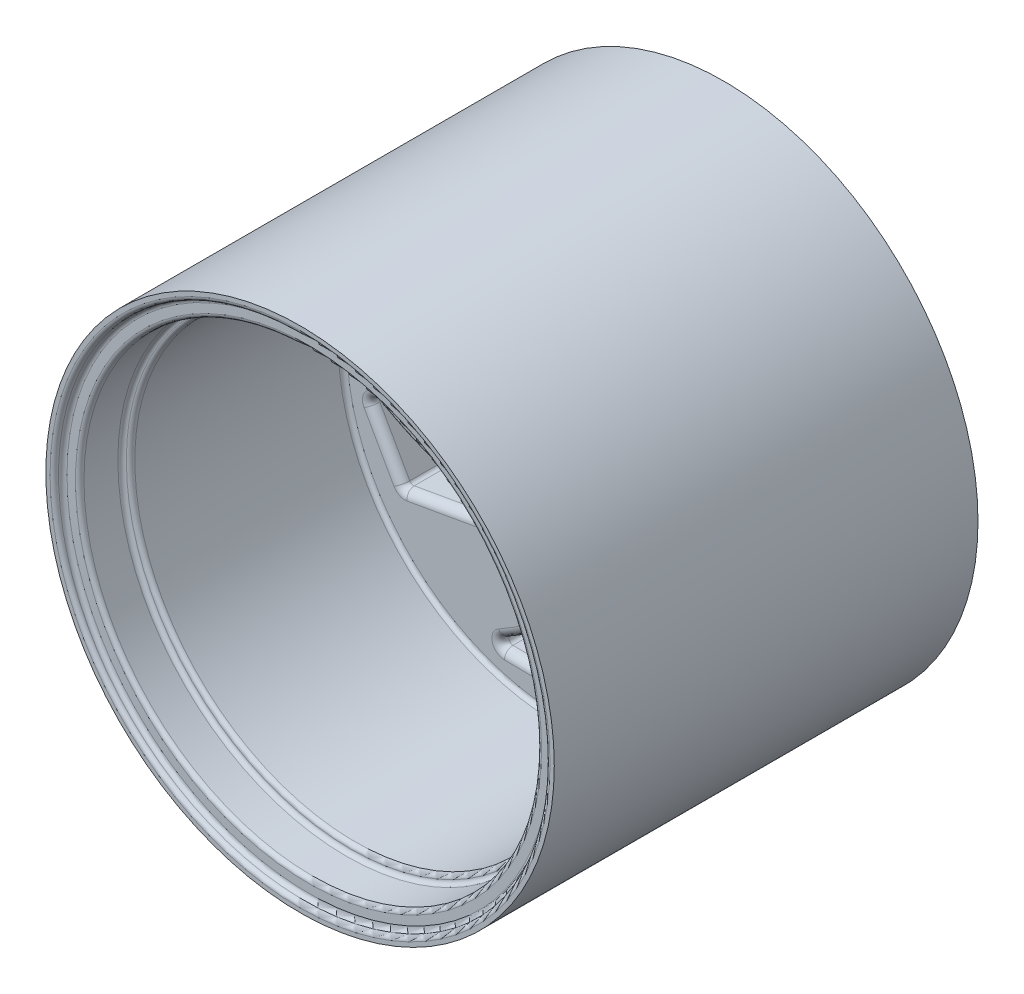
from build123d import *

# Parameters (mm, degrees)
IZIM1_R                     = 30
Y_KSEKLIK_EKSTR_ZYON1_DEPTH = 50
IZIM2_R                     = 29
KES_EKSTR_ZYON1_DEPTH       = 1
KES_EKSTR_ZYON2_START       = -1
IZIM3_R                     = 29
KES_EKSTR_ZYON2_DEPTH       = 1
IZIM4_R                     = 27
KES_EKSTR_ZYON3_DEPTH       = 5
IZIM5_R                     = 26
KES_EKSTR_ZYON4_DEPTH       = 25
IZIM6_R                     = 10
IZIM6_R_2                   = 8
IZIM6_R_3                   = 1
Y_KSEKLIK_EKSTR_ZYON2_DEPTH = 2
IZIM8_R                     = 2
KES_EKSTR_ZYON5_DEPTH       = 59.412250759
KES_EKSTR_ZYON6_DEPTH       = 59.412250759
IZIM12_R                    = 29
KES_EKSTR_ZYON7_DEPTH       = 10
Y_KSEKLIK_EKSTR_ZYON4_START = 10
Y_KSEKLIK_EKSTR_ZYON4_DEPTH = 10
RADYUS1_R                   = 0.5
RADYUS5_R                   = 0.5
RADYUS6_R                   = 1
RADYUS7_R                   = 0.5


# Some blends are built 0.0001 mm under size
with BuildPart() as part:
    # Çizim1 → Yükseklik-Ekstrüzyon1 (new body)
    with BuildSketch(Plane.XY):
        with Locations((-8.148787303, -1.554097453)):
            Circle(IZIM1_R)
    extrude(amount=Y_KSEKLIK_EKSTR_ZYON1_DEPTH)

    # Çizim2 → Kes-Ekstrüzyon1 (cut)
    with BuildSketch(Plane(origin=(0, 0, 0), x_dir=(-1, 0, 0), z_dir=(0, 0, -1))):
        with Locations((8.148787303, -1.554097453)):
            Circle(IZIM2_R)
    extrude(amount=-KES_EKSTR_ZYON1_DEPTH, mode=Mode.SUBTRACT)

    # Çizim3 → Kes-Ekstrüzyon2 (cut)
    with BuildSketch(Plane.XY.offset(50).offset(KES_EKSTR_ZYON2_START)):
        with Locations(Location((-8.148787303, -1.554097453, 0), (0, 0, 180))):
            Circle(IZIM3_R)
    extrude(amount=KES_EKSTR_ZYON2_DEPTH, mode=Mode.SUBTRACT)

    # Çizim4 → Kes-Ekstrüzyon3 (cut)
    with BuildSketch(Plane.XY.offset(49)):
        with Locations((-8.148787303, -1.554097453)):
            Circle(IZIM4_R)
    extrude(amount=-KES_EKSTR_ZYON3_DEPTH, mode=Mode.SUBTRACT)

    # Çizim5 → Kes-Ekstrüzyon4 (cut)
    with BuildSketch(Plane.XY.offset(44)):
        with Locations((-8.148787303, -1.554097453)):
            Circle(IZIM5_R)
    extrude(amount=-KES_EKSTR_ZYON4_DEPTH, mode=Mode.SUBTRACT)

    # Çizim6 → Yükseklik-Ekstrüzyon2 (add)
    # profile 1 of 9: a face of its own
    with BuildSketch(Plane.XY.offset(19)):
        with Locations((-8.148787303, -1.554097453)):
            Circle(IZIM6_R)
        with Locations((-8.148787303, -1.554097453)):
            Circle(IZIM6_R_2, mode=Mode.SUBTRACT)
    # profile 2 of 9: a face of its own
    with BuildSketch(Plane.XY.offset(19)):
        with Locations((-8.148787303, 4.445902547)):
            Circle(IZIM6_R_3)
    # profile 3 of 9: a face of its own
    with BuildSketch(Plane.XY.offset(19)):
        with Locations((-14.148787303, -1.554097453)):
            Circle(IZIM6_R_3)
    # profile 4 of 9: a face of its own
    with BuildSketch(Plane.XY.offset(19)):
        with Locations((-12.39142799, -5.79673814)):
            Circle(IZIM6_R_3)
    # profile 5 of 9: a face of its own
    with BuildSketch(Plane.XY.offset(19)):
        with Locations((-8.148787303, -7.554097453)):
            Circle(IZIM6_R_3)
    # profile 6 of 9: a face of its own
    with BuildSketch(Plane.XY.offset(19)):
        with Locations((-3.906146615, -5.79673814)):
            Circle(IZIM6_R_3)
    # profile 7 of 9: a face of its own
    with BuildSketch(Plane.XY.offset(19)):
        with Locations((-3.906146615, 2.688543234)):
            Circle(IZIM6_R_3)
    # profile 8 of 9: a face of its own
    with BuildSketch(Plane.XY.offset(19)):
        with Locations((-12.39142799, 2.688543234)):
            Circle(IZIM6_R_3)
    # profile 9 of 9: a face of its own
    with BuildSketch(Plane.XY.offset(19)):
        with Locations((-2.148787303, -1.554097453)):
            Circle(IZIM6_R_3)
    extrude(amount=Y_KSEKLIK_EKSTR_ZYON2_DEPTH)

    # Çizim8 → Kes-Ekstrüzyon5 (cut, through all)
    with BuildSketch(Plane.XY.offset(19)):
        with Locations((-8.148787303, -1.554097453)):
            Circle(IZIM8_R)
    extrude(amount=-KES_EKSTR_ZYON5_DEPTH, mode=Mode.SUBTRACT)

    # Çizim9 → Kes-Ekstrüzyon6 (cut, through all)
    with BuildSketch(Plane.XY.offset(19)):
        with BuildLine():
            Line((-13.925732405, 6.608433116), (-8.833557811, 20.638443128))
            Line((-8.833557811, 20.638443128), (0.723069615, 20.525490043))
            add(Edge.make_bspline(
                [(0.723069615, 20.525490043), (-8.727629056, 15.967451289), (-13.925732405, 6.608433116)],
                knots=[0, 0, 0, 1, 1, 1], degree=2))
        make_face()
        with BuildLine():
            Line((-3.968301022, 7.530149046), (10.72813136, 10.135201494))
            Line((10.72813136, 10.135201494), (15.408624833, 1.802442826))
            add(Edge.make_bspline(
                [(15.408624833, 1.802442826), (6.735898145, 7.707968582), (-3.968301022, 7.530149046)],
                knots=[0, 0, 0, 1, 1, 1], degree=2))
        make_face()
        with BuildLine():
            Line((1.80864408, -0.632381522), (11.412901869, -12.057339087))
            Line((11.412901869, -12.057339087), (6.536767916, -20.277144671))
            add(Edge.make_bspline(
                [(6.536767916, -20.277144671), (7.314739899, -9.813580161), (1.80864408, -0.632381522)],
                knots=[0, 0, 0, 1, 1, 1], degree=2))
        make_face()
        with BuildLine():
            Line((-2.3718422, -9.716628021), (-7.464016794, -23.746638033))
            Line((-7.464016794, -23.746638033), (-17.02064422, -23.633684949))
            add(Edge.make_bspline(
                [(-17.02064422, -23.633684949), (-7.569945549, -19.075646195), (-2.3718422, -9.716628021)],
                knots=[0, 0, 0, 1, 1, 1], degree=2))
        make_face()
        with BuildLine():
            Line((-12.329273583, -10.638343952), (-27.025705965, -13.243396399))
            Line((-27.025705965, -13.243396399), (-31.706199438, -4.910637732))
            add(Edge.make_bspline(
                [(-31.706199438, -4.910637732), (-23.03347275, -10.816163487), (-12.329273583, -10.638343952)],
                knots=[0, 0, 0, 1, 1, 1], degree=2))
        make_face()
        with BuildLine():
            Line((-18.106218685, -2.475813384), (-27.710476474, 8.949144181))
            Line((-27.710476474, 8.949144181), (-22.834342521, 17.168949765))
            add(Edge.make_bspline(
                [(-22.834342521, 17.168949765), (-23.612314504, 6.705385255), (-18.106218685, -2.475813384)],
                knots=[0, 0, 0, 1, 1, 1], degree=2))
        make_face()
    extrude(amount=-KES_EKSTR_ZYON6_DEPTH, mode=Mode.SUBTRACT)

    # Çizim12 → Kes-Ekstrüzyon7 (cut)
    with BuildSketch(Plane(origin=(0, 0, 1), x_dir=(-1, 0, 0), z_dir=(0, 0, -1))):
        with Locations((8.148787303, -1.554097453)):
            Circle(IZIM12_R)
    extrude(amount=-KES_EKSTR_ZYON7_DEPTH, mode=Mode.SUBTRACT)

    # Çizim13 → Yükseklik-Ekstrüzyon4 (add)
    with BuildSketch(Plane(origin=(0, 0, 11), x_dir=(-1, 0, 0), z_dir=(0, 0, -1)).offset(Y_KSEKLIK_EKSTR_ZYON4_START)):
        with BuildLine():
            Line((25.695028079, 21.53686796), (26.090507249, 21.230932957))
            Line((26.090507249, 21.230932957), (13.239027353, 4.617568143))
            ThreePointArc((13.239027353, 4.617568143), (15.55174657, 1.478425274), (16.105928887, -2.381078591))
            Line((16.105928887, -2.381078591), (36.919270337, -5.204105))
            Line((36.919270337, -5.204105), (36.852062437, -5.699567509))
            Line((36.852062437, -5.699567509), (16.038726518, -2.87654185))
            ThreePointArc((16.038726518, -2.87654185), (14.476508655, -6.448986878), (11.411171421, -8.858674776))
            Line((11.411171421, -8.858674776), (19.37302956, -28.295070413))
            Line((19.37302956, -28.295070413), (18.91034249, -28.484597919))
            Line((18.91034249, -28.484597919), (10.948486467, -9.048207446))
            ThreePointArc((10.948486467, -9.048207446), (7.073549388, -9.481509605), (3.454029836, -8.031693638))
            Line((3.454029836, -8.031693638), (-9.397453474, -24.645062866))
            Line((-9.397453474, -24.645062866), (-9.792932644, -24.339127863))
            Line((-9.792932644, -24.339127863), (3.058547252, -7.725763049))
            ThreePointArc((3.058547252, -7.725763049), (0.745828035, -4.58662018), (0.191645718, -0.727116315))
            Line((0.191645718, -0.727116315), (-20.621695731, 2.095910094))
            Line((-20.621695731, 2.095910094), (-20.554487832, 2.591372603))
            Line((-20.554487832, 2.591372603), (0.258848088, -0.231653055))
            ThreePointArc((0.258848088, -0.231653055), (1.82106595, 3.340791972), (4.886403184, 5.75047987))
            Line((4.886403184, 5.75047987), (-3.075454955, 25.186875507))
            Line((-3.075454955, 25.186875507), (-2.612767885, 25.376403013))
            Line((-2.612767885, 25.376403013), (5.349088138, 5.94001254))
            ThreePointArc((5.349088138, 5.94001254), (9.224025217, 6.373314699), (12.843544769, 4.923498732))
            Line((12.843544769, 4.923498732), (25.695028079, 21.53686796))
        make_face()
        Polygon((13.35894405, -5.185570983), (13.898814007, 1.142293883), (8.688657259, 4.773767413), (2.938630555, 2.077376077), (2.398760599, -4.250488789), (7.608917346, -7.881962319), align=None, mode=Mode.SUBTRACT)
    extrude(amount=-Y_KSEKLIK_EKSTR_ZYON4_DEPTH)

    # Radyus1
    radyus1_edges = [part.edges().sort_by_distance(p)[0] for p in [
        (20.851212697, -1.554097453, 49),
        (20.851212697, -1.554097453, 50),
        (-35.148787303, -1.554097453, 44),
        (-35.148787303, -1.554097453, 49),
        (-34.148787303, -1.554097453, 19),
        (-34.148787303, -1.554097453, 44),
    ]]
    fillet(radyus1_edges, radius=RADYUS1_R - 0.0001)  # a hair under: the kernel refuses the full size

    # Radyus5
    # the kernel refuses this fillet: 0.5 mm, written as the material it adds along each edge
    with BuildSketch(Plane(origin=(-22.834342521, 17.168949765, 19), x_dir=(-0.045917830144074794, -0.9989452201571715, 0), z_dir=(0, 0, -1)), Plane(origin=(-31.706199438, -4.910637732, 19), x_dir=(0.8421530225731109, -0.5392386174700152, 0), z_dir=(0, 0, -1)), Plane(origin=(-17.02064422, -23.633684949, 19), x_dir=(0.888070852717188, 0.459706602687156, 0), z_dir=(0, 0, -1)), Plane(origin=(6.536767916, -20.277144671, 19), x_dir=(0.045917830144079165, 0.9989452201571712, 0), z_dir=(0, 0, -1)), Plane(origin=(15.408624833, 1.802442826, 19), x_dir=(-0.8421530225731088, 0.5392386174700184, 0), z_dir=(0, 0, -1)), Plane(origin=(0.723069615, 20.525490043, 19), x_dir=(-0.8880708527171902, -0.45970660268715174, 0), z_dir=(0, 0, -1))) as radyus5_piece_1:
        with BuildLine():
            CenterArc((2.001629054, 0.499794242), RADYUS5_R, 118.04534383, 150.310869402)
            Line((1.766543964, 0.941082131), (1.761842262, 0.949907889))
            Line((1.761842262, 0.949907889), (-0.004701702, 0.008825758))
            Line((-0.004701702, 0.008825758), (0.000282763, -0.009996001))
            ThreePointArc((0.000282763, -0.009996001), (0.993642712, 0.00415476), (1.98699942, -0.009995885))
            Line((1.98699942, -0.009995885), (1.987286276, 0))
        make_face()
    extrude(amount=8)
    with BuildSketch(Plane(origin=(-18.106218685, -2.475813384, 19), x_dir=(-0.4605887665447725, 0.8876136480095184, 0), z_dir=(0, 0, -1)), Plane(origin=(-12.329273583, -10.638343952, 19), x_dir=(-0.998990351194408, 0.04492525147924159, 0), z_dir=(0, 0, -1)), Plane(origin=(-2.3718422, -9.716628021, 19), x_dir=(-0.5384015846496285, -0.8426883965302768, 0), z_dir=(0, 0, -1)), Plane(origin=(1.80864408, -0.632381522, 19), x_dir=(0.46058876654478326, -0.8876136480095126, 0), z_dir=(0, 0, -1)), Plane(origin=(-3.968301022, 7.530149046, 19), x_dir=(0.9989903511944087, -0.044925251479229544, 0), z_dir=(0, 0, -1)), Plane(origin=(-13.925732405, 6.608433116, 19), x_dir=(0.5384015846496182, 0.8426883965302833, 0), z_dir=(0, 0, -1))) as radyus5_piece_2:
        with BuildLine():
            CenterArc((4.514789372, -0.498983263), RADYUS5_R, 93.654521519, 163.718887163)
            Line((4.405491299, -0.986890971), (4.403305337, -0.996649125))
            Line((4.403305337, -0.996649125), (-0.002185961, -0.009758154))
            Line((-0.002185961, -0.009758154), (0.000615121, 0.009981063))
            ThreePointArc((0.000615121, 0.009981063), (2.241425805, -0.060297124), (4.482281874, 0.009979665))
            Line((4.482281874, 0.009979665), (4.482919275, 0))
        make_face()
    extrude(amount=8)
    with BuildSketch(Plane(origin=(-27.710476474, 8.949144181, 19), x_dir=(0.6434785417464973, -0.7654641508991792, 0), z_dir=(0, 0, -1)), Plane(origin=(-27.025705965, -13.243396399, 19), x_dir=(0.984650671238221, 0.17453668849305284, 0), z_dir=(0, 0, -1)), Plane(origin=(-7.464016794, -23.746638033, 19), x_dir=(0.34117212949171294, 0.9400008393922262, 0), z_dir=(0, 0, -1)), Plane(origin=(11.412901869, -12.057339087, 19), x_dir=(-0.6434785417465096, 0.7654641508991689, 0), z_dir=(0, 0, -1)), Plane(origin=(10.72813136, 10.135201494, 19), x_dir=(-0.9846506712382194, -0.17453668849306167, 0), z_dir=(0, 0, -1)), Plane(origin=(-8.833557811, 20.638443128, 19), x_dir=(-0.3411721294917053, -0.9400008393922289, 0), z_dir=(0, 0, -1))) as radyus5_piece_3:
        with BuildLine():
            CenterArc((RADYUS5_R * 0.70972912952, -RADYUS5_R), RADYUS5_R, 90, 70.728864475)
            Line((-RADYUS5_R * 0.234238208874, -RADYUS5_R * 0.669961117373), (-RADYUS5_R * 0.253117555642, -RADYUS5_R * 0.663360339721))
            Line((-RADYUS5_R * 0.253117555642, -RADYUS5_R * 0.663360339721), (-RADYUS5_R * 0.0141945825904, RADYUS5_R * 0.02))
            Line((-RADYUS5_R * 0.0141945825904, RADYUS5_R * 0.02), (RADYUS5_R * 0.70972912952, RADYUS5_R * 0.02))
            Line((RADYUS5_R * 0.70972912952, RADYUS5_R * 0.02), (RADYUS5_R * 0.70972912952, 0))
        make_face()
    extrude(amount=8)

    # Radyus6
    radyus6_edges = [part.edges().sort_by_distance(p)[0] for p in [
        (-25.692486189, 12.350914512, 19),
        (-22.298959889, 8.192351844, 19),
        (-24.246722562, 4.828759001, 19),
        (-23.664546284, -8.935281732, 19),
        (-21.725470771, -12.303890109, 19),
        (-28.962730347, -9.794880383, 19),
        (-11.419031461, -23.699892348, 19),
        (-9.514373698, -18.681731029, 19),
        (-5.627535511, -18.686746564, 19),
        (9.394911584, -15.459109418, 19),
        (6.001385284, -11.30054675, 19),
        (7.949147957, -7.936953907, 19),
        (7.366971679, 5.827086826, 19),
        (5.427896165, 9.195695204, 19),
        (12.665155742, 6.686685477, 19),
        (-4.878543145, 20.591697442, 19),
        (-6.783200908, 15.573536124, 19),
        (-10.670039095, 15.578551658, 19),
        (-23.289106196, 15.67341291, 19),
        (-20.364282606, 0.877314736, 19),
        (-27.597724453, 8.958388855, 19),
        (-16.362199677, -10.917320611, 19),
        (-26.977336077, -13.141127948, 19),
        (-30.638408368, -6.052243055, 19),
        (-15.498089474, -23.279753418, 19),
        (-4.146704373, -13.3487328, 19),
        (-7.528398927, -23.653614256, 19),
        (6.991531591, -18.781607816, 19),
        (4.066708001, -3.985509642, 19),
        (11.300149848, -12.066583761, 19),
        (0.064625072, 7.809125705, 19),
        (14.340833763, 2.944048149, 19),
        (10.679761472, 10.032933042, 19),
        (-0.799485131, 20.171558512, 19),
        (-12.150870232, 10.240537894, 19),
        (-8.769175678, 20.54541935, 19),
    ]]
    fillet(radyus6_edges, radius=RADYUS6_R)

    # Radyus7
    radyus7_edges = [part.edges().sort_by_distance(p)[0] for p in [
        (-18.148787303, -1.554097453, 19),
        (-16.148787303, -1.554097453, 19),
        (-16.148787303, -1.554097453, 21),
        (-18.148787303, -1.554097453, 21),
        (-9.148787303, 4.445902547, 19),
        (-9.148787303, 4.445902547, 21),
        (-15.148787303, -1.554097453, 19),
        (-15.148787303, -1.554097453, 21),
        (-13.39142799, -5.79673814, 19),
        (-13.39142799, -5.79673814, 21),
        (-9.148787303, -7.554097453, 19),
        (-9.148787303, -7.554097453, 21),
        (-4.906146615, -5.79673814, 19),
        (-4.906146615, -5.79673814, 21),
        (-4.906146615, 2.688543234, 19),
        (-4.906146615, 2.688543234, 21),
        (-13.39142799, 2.688543234, 19),
        (-13.39142799, 2.688543234, 21),
        (-3.148787303, -1.554097453, 19),
        (-3.148787303, -1.554097453, 21),
    ]]
    fillet(radyus7_edges, radius=RADYUS7_R - 0.0001)  # a hair under: the kernel refuses the full size


solid = part.part
